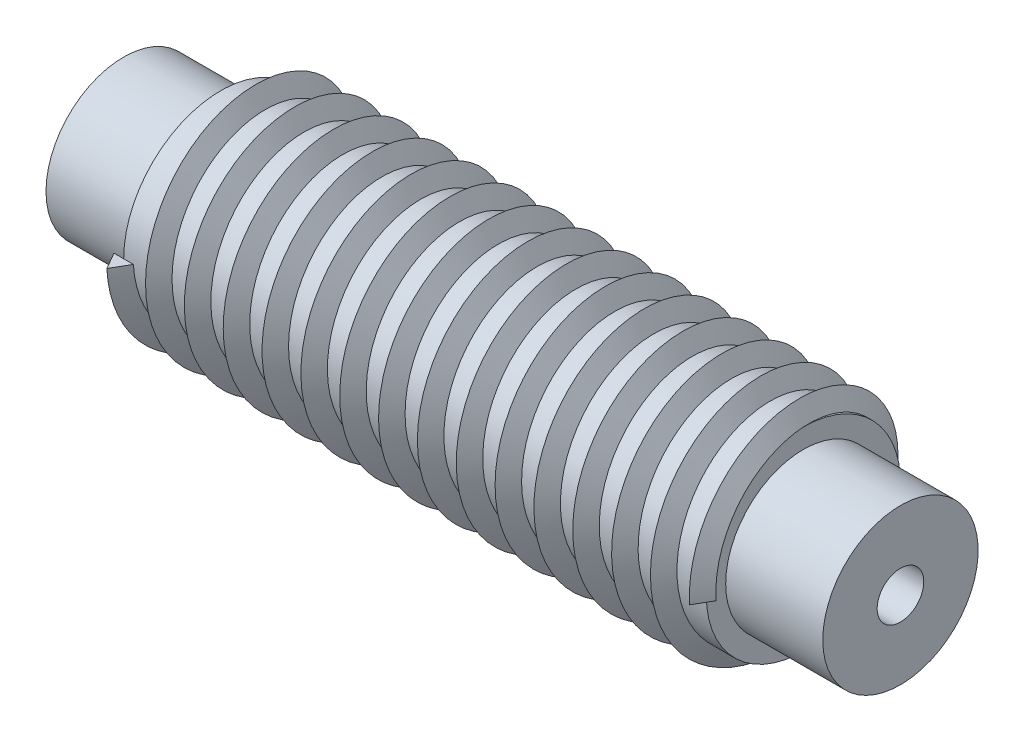
from build123d import *

# Parameters (mm, degrees)
SWEEP2_PITCH       = 5
SKETCH4_R          = 3
CUT_EXTRUDE1_DEPTH = 10


with BuildPart() as part:
    # Sketch1 → Revolve1 (revolve)
    with BuildSketch(Plane.XY, mode=Mode.PRIVATE) as revolve1_sk:
        Polygon((0, 0), (100, 0), (100, 10), (87.5, 10), (87.5, 12.5), (12.5, 12.5), (12.5, 10), (0, 10), align=None)
    revolve(revolve1_sk.sketch.rotate(Axis((0, 0, 0), (1, 0, 0)), 90), axis=Axis((0, 0, 0), (1, 0, 0)))

    # Sweep2: arcs per turn and ends read off the stored shape
    # Sweep2: the profile of Sketch3 screwed along a right-hand helix through 15 turns, 12 arcs to a turn; built about Z, then put on its axis
    sweep2_z = Axis((0, 0, 0), (0, 0, 1))
    sweep2_corners = [(12.5, 0, 0), (12.5, 0, -1.25), (14.665063509, 0, 0), (12.5, 0, 1.25)]
    with BuildLine(mode=Mode.PRIVATE) as sweep2_profile:
        Line(sweep2_corners[0], sweep2_corners[1])
        Line(sweep2_corners[1], sweep2_corners[2])
        Line(sweep2_corners[2], sweep2_corners[3])
        Line(sweep2_corners[3], sweep2_corners[0])
    sweep2_cap = Face(sweep2_profile.wire())
    sweep2_turn_angles = [0, 15, 30, 45, 60, 75, 90, 105, 120, 135, 150, 165, 180, 195, 210, 225, 240, 255, 270, 285, 300, 315, 330, 345, 360]
    sweep2_turn_weights = [1, 0.9659258262890683, 1, 0.9659258262890683, 1, 0.9659258262890683, 1, 0.9659258262890683, 1, 0.9659258262890683, 1, 0.9659258262890683, 1, 0.9659258262890683, 1, 0.9659258262890683, 1, 0.9659258262890683, 1, 0.9659258262890683, 1, 0.9659258262890683, 1, 0.9659258262890683, 1]
    sweep2_turn_rails = [Edge.make_bspline([Vector(p[0], p[1], 0).rotate(sweep2_z, sweep2_turn_angles[k]) / sweep2_turn_weights[k] + Vector(0, 0, p[2] + SWEEP2_PITCH * sweep2_turn_angles[k] / 360) for k in range(25)], [0, 0, 0, 1, 1, 2, 2, 3, 3, 4, 4, 5, 5, 6, 6, 7, 7, 8, 8, 9, 9, 10, 10, 11, 11, 12, 12, 12], 2, sweep2_turn_weights) for p in sweep2_corners]
    sweep2_turn_sides = [Face.make_surface_from_curves(sweep2_turn_rails[p[0]], sweep2_turn_rails[p[1]]) for p in [(0, 1), (1, 2), (2, 3), (3, 0)]]
    sweep2 = Plane(origin=(87.5, 0, 0), x_dir=(0, 0, 1), z_dir=(-1, 0, 0)) * Solid(Shell([*[p.moved(Location((0, 0, SWEEP2_PITCH * i))) for i in range(15) for p in sweep2_turn_sides], sweep2_cap, sweep2_cap.rotate(sweep2_z, 5400).moved(Location((0, 0, SWEEP2_PITCH * 5400 / 360)))]))
    add(sweep2)

    # Sketch4 → Cut-Extrude1 (cut)
    with BuildSketch(Plane(origin=(100, 0, 0), x_dir=(0, 0, -1), z_dir=(1, 0, 0))):
        Circle(SKETCH4_R)
    extrude(amount=-CUT_EXTRUDE1_DEPTH, mode=Mode.SUBTRACT)


solid = part.part
